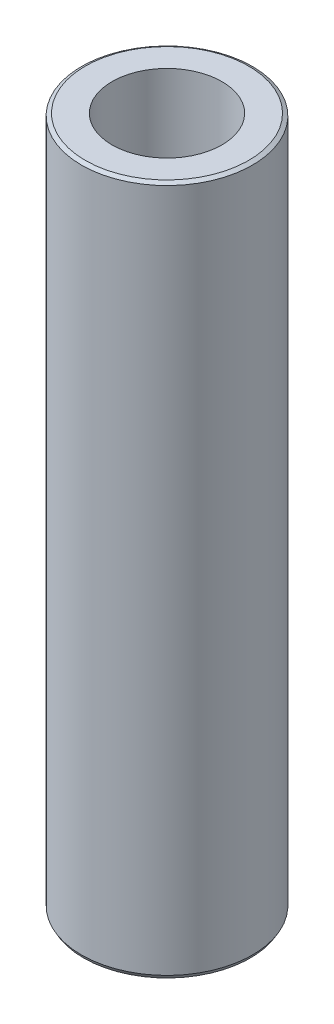
from build123d import *
from OCP.BRepFilletAPI import BRepFilletAPI_MakeChamfer

# Parameters (mm, degrees)
SKETCH1_R           = 20
BOSS_EXTRUDE1_DEPTH = 161.413607097
SKETCH2_R           = 12.852184265
CUT_EXTRUDE1_DEPTH  = 164.872976894
CHAMFER1_SIZE       = 0.512045892
CHAMFER1_SIZE2      = 0.8868895


with BuildPart() as part:
    # Sketch1 → Boss-Extrude1 (new body)
    with BuildSketch(Plane(origin=(0, 0, 0), x_dir=(1, 0, 0), z_dir=(0, 1, 0))):
        Circle(SKETCH1_R)
    extrude(amount=BOSS_EXTRUDE1_DEPTH)

    # Sketch2 → Cut-Extrude1 (cut, through all)
    with BuildSketch(Plane(origin=(0, 0, 0), x_dir=(1, 0, 0), z_dir=(0, 1, 0))):
        Circle(SKETCH2_R)
    extrude(amount=CUT_EXTRUDE1_DEPTH, mode=Mode.SUBTRACT)

    # Chamfer1: one chamfer whose edges measure the first distance from different faces: ONE call of the kernel's chamfer builder (chamfer() names one face for all edges)
    chamfer1_edges_1 = [part.edges().sort_by_distance(p)[0] for p in [
        (-20, 161.413607097, 0),
    ]]
    chamfer1_side_1 = [part.faces().sort_by_distance(p)[0] for p in [
        (-20, 80.706803549, 0),
    ]]
    chamfer1_edges_2 = [part.edges().sort_by_distance(p)[0] for p in [
        (-20, 0, 0),
    ]]
    chamfer1_side_2 = [part.faces().sort_by_distance(p)[0] for p in [
        (-19.434314575, 0, 0),
    ]]
    chamfer1 = BRepFilletAPI_MakeChamfer(part.part.solid().wrapped)
    for e in chamfer1_edges_1:
        chamfer1.Add(CHAMFER1_SIZE, CHAMFER1_SIZE2, e.wrapped, chamfer1_side_1[0].wrapped)  # the first distance lies on this face
    for e in chamfer1_edges_2:
        chamfer1.Add(CHAMFER1_SIZE, CHAMFER1_SIZE2, e.wrapped, chamfer1_side_2[0].wrapped)  # the first distance lies on this face
    add(Compound.cast(chamfer1.Shape()), mode=Mode.REPLACE)


solid = part.part
